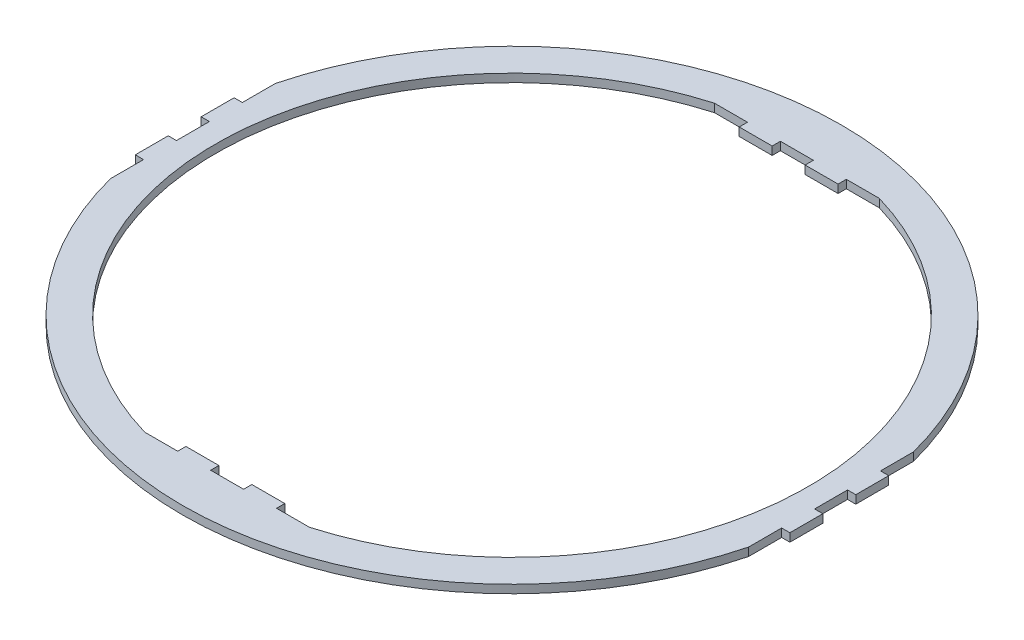
from build123d import *

# Parameters (mm, degrees)
BOSS_EXTRUDE1_DEPTH = 3.175


with BuildPart() as part:
    # Sketch1 → Boss-Extrude1 (new body)
    with BuildSketch(Plane(origin=(0, 0, 0), x_dir=(1, 0, 0), z_dir=(0, 1, 0))):
        with BuildLine():
            Line((122.967221242, -31.75), (122.967221242, -19.05))
            Line((122.967221242, -19.05), (126.142221242, -19.05))
            Line((126.142221242, -19.05), (126.142221242, -6.35))
            Line((126.142221242, -6.35), (122.967221242, -6.35))
            Line((122.967221242, -6.35), (122.967221242, 6.35))
            Line((122.967221242, 6.35), (126.142221242, 6.35))
            Line((126.142221242, 6.35), (126.142221242, 19.05))
            Line((126.142221242, 19.05), (122.967221242, 19.05))
            Line((122.967221242, 19.05), (122.967221242, 31.75))
            ThreePointArc((122.967221242, 31.75), (0, 127), (-122.967221242, 31.75))
            Line((-122.967221242, 31.75), (-122.967221242, 19.05))
            Line((-122.967221242, 19.05), (-126.142221242, 19.05))
            Line((-126.142221242, 19.05), (-126.142221242, 6.35))
            Line((-126.142221242, 6.35), (-122.967221242, 6.35))
            Line((-122.967221242, 6.35), (-122.967221242, -6.35))
            Line((-122.967221242, -6.35), (-126.142221242, -6.35))
            Line((-126.142221242, -6.35), (-126.142221242, -19.05))
            Line((-126.142221242, -19.05), (-122.967221242, -19.05))
            Line((-122.967221242, -19.05), (-122.967221242, -31.75))
            ThreePointArc((-122.967221242, -31.75), (0, -127), (122.967221242, -31.75))
        make_face()
        with BuildLine():
            Line((-31.75, 109.801764558), (-19.05, 109.801764558))
            Line((-19.05, 109.801764558), (-19.05, 106.626764558))
            Line((-19.05, 106.626764558), (-6.35, 106.626764558))
            Line((-6.35, 106.626764558), (-6.35, 109.801764558))
            Line((-6.35, 109.801764558), (6.35, 109.801764558))
            Line((6.35, 109.801764558), (6.35, 106.626764558))
            Line((6.35, 106.626764558), (19.05, 106.626764558))
            Line((19.05, 106.626764558), (19.05, 109.801764558))
            Line((19.05, 109.801764558), (31.75, 109.801764558))
            ThreePointArc((31.75, 109.801764558), (114.3, 0), (31.75, -109.801764558))
            Line((31.75, -109.801764558), (19.05, -109.801764558))
            Line((19.05, -109.801764558), (19.05, -106.626764558))
            Line((19.05, -106.626764558), (6.35, -106.626764558))
            Line((6.35, -106.626764558), (6.35, -109.801764558))
            Line((6.35, -109.801764558), (-6.35, -109.801764558))
            Line((-6.35, -109.801764558), (-6.35, -106.626764558))
            Line((-6.35, -106.626764558), (-19.05, -106.626764558))
            Line((-19.05, -106.626764558), (-19.05, -109.801764558))
            Line((-19.05, -109.801764558), (-31.75, -109.801764558))
            ThreePointArc((-31.75, -109.801764558), (-114.3, 0), (-31.75, 109.801764558))
        make_face(mode=Mode.SUBTRACT)
    extrude(amount=BOSS_EXTRUDE1_DEPTH)


solid = part.part
